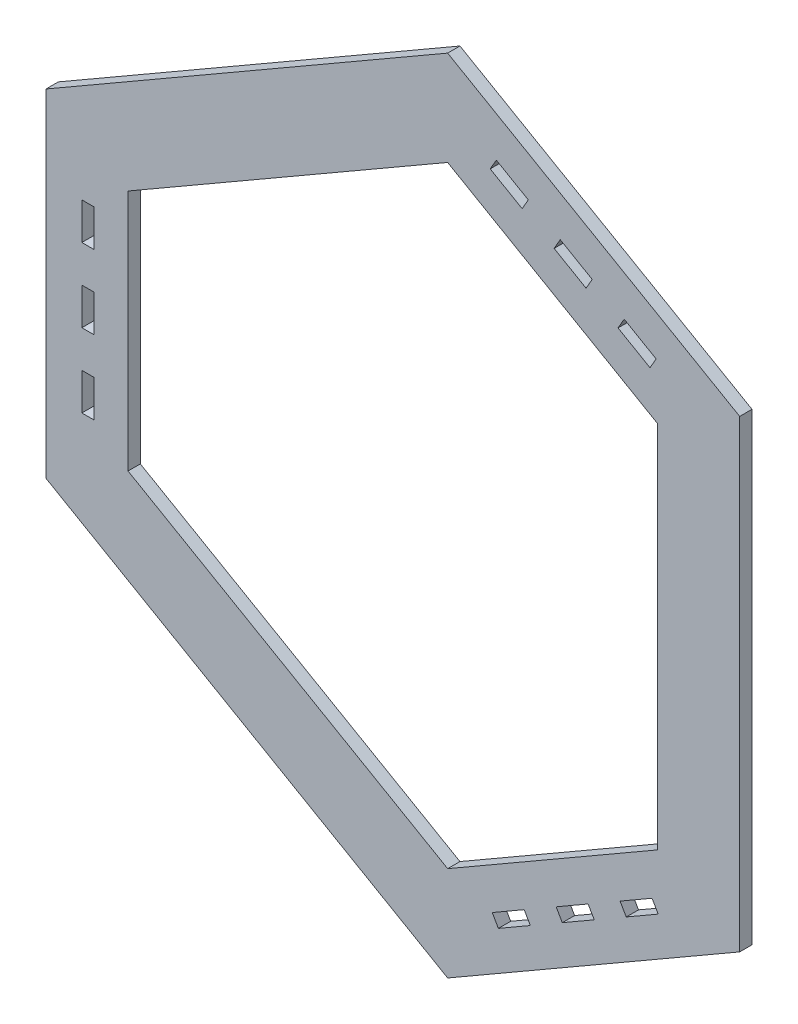
from build123d import *

# Parameters (mm, degrees)
BOSS_EXTRU_1_DEPTH   = 6
EMPREINTE1_OUTLINE_W = 6
EMPREINTE1_OUTLINE_H = 18
EMPREINTE1_DEPTH     = 6


# Read off the part's stored shape, not the designer's step: Empreinte1
with BuildPart() as part:
    # Esquisse1 → Boss.-Extru.1 (new body)
    with BuildSketch(Plane.XY):
        Polygon((-286.806510123, 2.22734392), (-90.921937441, 115.321354688), (51.5, 33.094010768), (51.5, -193.094010768), (-90.921937441, -275.321354688), (-286.806510123, -162.22734392), align=None)
        Polygon((-246.806510123, -139.133333153), (-246.806510123, -20.866666847), (-90.921937441, 69.133333153), (11.5, 10), (11.5, -170), (-90.921937441, -229.133333153), align=None, mode=Mode.SUBTRACT)
    extrude(amount=BOSS_EXTRU_1_DEPTH)

    # Empreinte1 outline → Empreinte1 (cut)
    with BuildSketch(Plane.XY):
        Polygon((-6.833974392, -200.800909817), (-3.833974392, -205.99706224), (11.754482876, -196.99706224), (8.754482876, -191.800909817), align=None)
        Polygon((-22.42243166, -209.800909817), (-38.010888928, -218.800909817), (-35.010888928, -223.99706224), (-19.42243166, -214.99706224), align=None)
        Polygon((-53.599346196, -227.800909817), (-69.187803464, -236.800909817), (-66.187803464, -241.99706224), (-50.599346196, -232.99706224), align=None)
        with Locations((-266.319584862, -116.867002045)):
            Rectangle(EMPREINTE1_OUTLINE_W, EMPREINTE1_OUTLINE_H)
        with Locations((-266.319584862, -80.867002045)):
            Rectangle(EMPREINTE1_OUTLINE_W, EMPREINTE1_OUTLINE_H)
        with Locations((-266.319584862, -44.867002045)):
            Rectangle(EMPREINTE1_OUTLINE_W, EMPREINTE1_OUTLINE_H)
        Polygon((-54.593654623, 67.789098441), (-51.593654623, 72.985250863), (-67.182111891, 81.985250863), (-70.182111891, 76.789098441), align=None)
        Polygon((-39.005197355, 58.789098441), (-23.416740087, 49.789098441), (-20.416740087, 54.985250863), (-36.005197355, 63.985250863), align=None)
        Polygon((-7.828282819, 40.789098441), (7.76017445, 31.789098441), (10.76017445, 36.985250863), (-4.828282819, 45.985250863), align=None)
    extrude(amount=EMPREINTE1_DEPTH, mode=Mode.SUBTRACT)


solid = part.part
